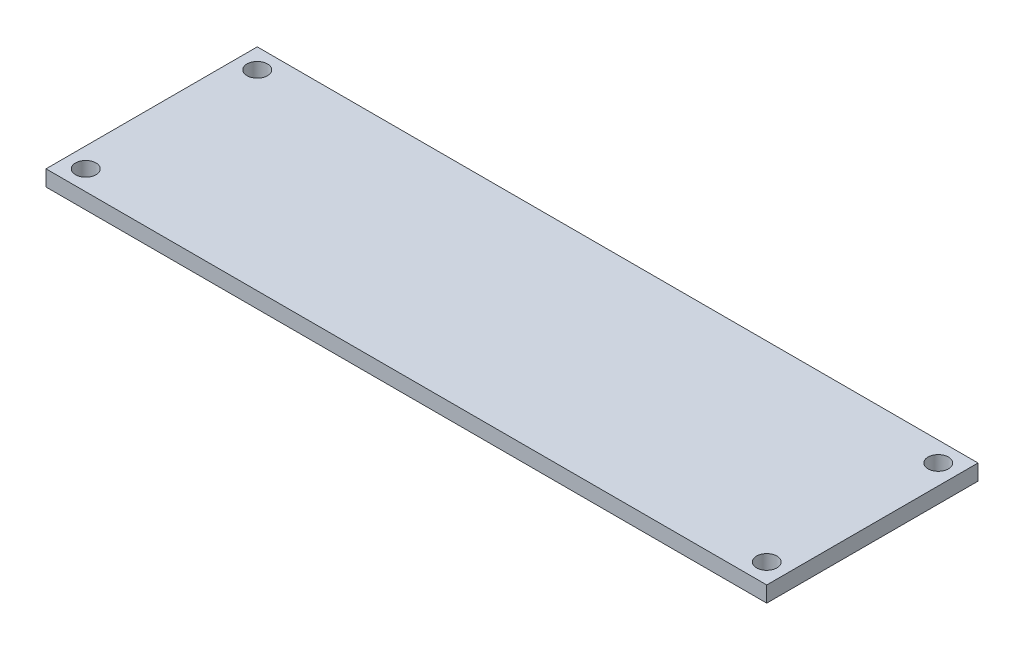
from build123d import *

# Parameters (mm, degrees)
SKETCH1_W           = 58
SKETCH1_H           = 17
SKETCH1_R           = 0.825
BOSS_EXTRUDE1_DEPTH = 1.27


with BuildPart() as part:
    # Sketch1 → Boss-Extrude1 (new body)
    with BuildSketch(Plane.XZ.offset(0.635)):
        Rectangle(SKETCH1_W, SKETCH1_H)
        with Locations((27.4, -6.9)):
            Circle(SKETCH1_R, mode=Mode.SUBTRACT)
        with Locations((27.4, 6.9)):
            Circle(SKETCH1_R, mode=Mode.SUBTRACT)
        with Locations((-27.4, -6.9)):
            Circle(SKETCH1_R, mode=Mode.SUBTRACT)
        with Locations((-27.4, 6.9)):
            Circle(SKETCH1_R, mode=Mode.SUBTRACT)
    extrude(amount=-BOSS_EXTRUDE1_DEPTH)


solid = part.part
